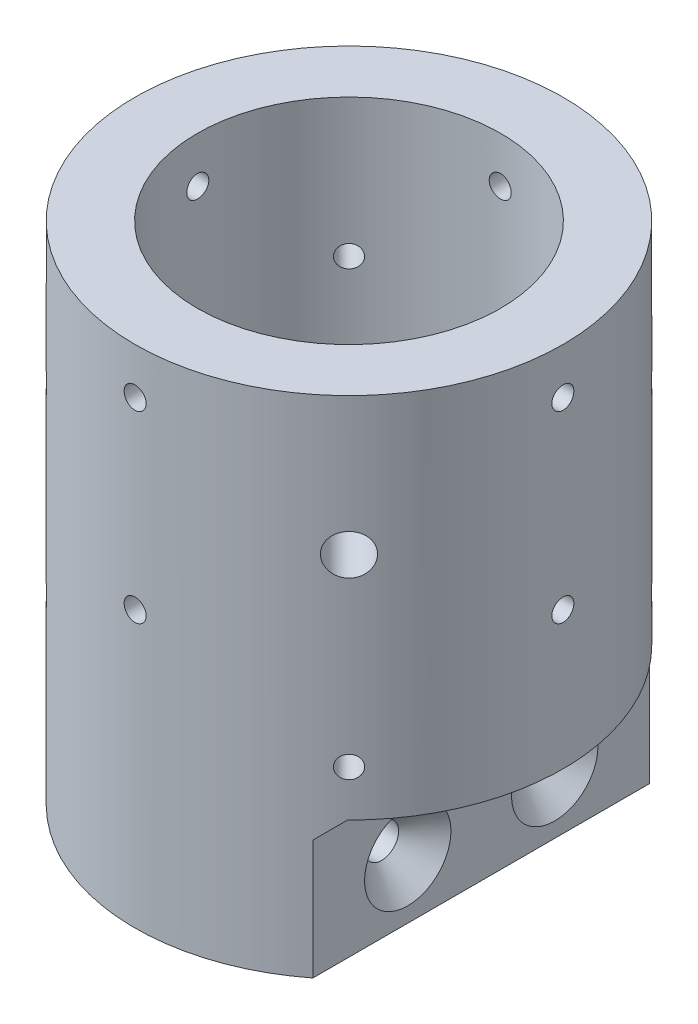
from build123d import *

# Parameters (mm, degrees)
SKETCH_1_R                       = 23.3
EXTRUDE_1_DEPTH                  = 5
SKETCH_2_R                       = 23.3
SKETCH_2_R_2                     = 16.5
EXTRUDE_2_DEPTH                  = 35
CHAMFER_8_SIZE                   = 2
SKETCH_3_R                       = 1.2
CUT_EXTRUDE_1_DEPTH              = 52.824511575
CUT_EXTRUDE_START                = -16.3
SKETCH_4_R                       = 1.2
CUT_EXTRUDE_2_DEPTH              = 36.524511747
PATTERN_CIRCULAR_1_COUNT         = 4
PATTERN_CIRCULAR_2_COUNT         = 4
PATTERN_LINEAR_3_COUNT           = 2
PATTERN_LINEAR_3_PITCH           = 20
PATTERN_START                    = -16.3
PATTERN_LINEAR_3_COPY_1_SKETCH_R = 1.2
PATTERN_LINEAR_3_COPY_1_DEPTH    = 36.524511747
PATTERN_LINEAR_3_COPY_2_SKETCH_R = 1.2
PATTERN_LINEAR_3_COPY_2_DEPTH    = 36.524511747
PATTERN_LINEAR_3_COPY_3_SKETCH_R = 1.2
PATTERN_LINEAR_3_COPY_3_DEPTH    = 36.524511747
PATTERN_LINEAR_4_COUNT           = 2
PATTERN_LINEAR_4_PITCH           = 20
PATTERN_LINEAR_4_COPY_1_SKETCH_R = 1.2
PATTERN_LINEAR_4_COPY_1_DEPTH    = 52.824511575
PATTERN_LINEAR_4_COPY_2_SKETCH_R = 1.2
PATTERN_LINEAR_4_COPY_2_DEPTH    = 52.824511575
PATTERN_LINEAR_4_COPY_3_SKETCH_R = 1.2
PATTERN_LINEAR_4_COPY_3_DEPTH    = 52.824511575
EXTRUDE_START                    = 15
EXTRUDE_3_DEPTH                  = 15
CUT_EXTRUDE_10_DEPTH             = 15
CHAMFER_4_SIZE                   = 2
CHAMFER_6_SIZE                   = 2
CHAMFER_7_SIZE                   = 2
HOLE_WIZARD_M41_D                = 3.7
HOLE_WIZARD_M41_CSINK_D          = 9.4
HOLE_WIZARD_M41_CSINK_ANGLE      = 90
SKETCH_17_R                      = 2.5
CUT_EXTRUDE_11_DEPTH             = 86
SKETCH_18_R                      = 2.2
SKETCH_18_R_2                    = 1.2
CUT_EXTRUDE_12_DEPTH             = 86


with BuildPart() as part:
    # Эскиз1 → Бобышка-Вытянуть1 (new body)
    with BuildSketch(Plane(origin=(0, 0, 0), x_dir=(1, 0, 0), z_dir=(0, 1, 0))):
        with Locations(Location((0, 0, 0), (0, 0, 270))):
            Circle(SKETCH_1_R)
    extrude(amount=EXTRUDE_1_DEPTH)

    # Эскиз2 → Бобышка-Вытянуть2 (add)
    with BuildSketch(Plane(origin=(0, 5, 0), x_dir=(1, 0, 0), z_dir=(0, 1, 0))):
        with Locations(Location((0, 0, 0), (0, 0, 270))):
            Circle(SKETCH_2_R)
        with Locations(Location((0, 0, 0), (0, 0, 270))):
            Circle(SKETCH_2_R_2, mode=Mode.SUBTRACT)
    extrude(amount=EXTRUDE_2_DEPTH)

    # Фаска8
    chamfer_8_edges = [part.edges().sort_by_distance(p)[0] for p in [
        (0, 5, -16.5),
    ]]
    chamfer(chamfer_8_edges, length=CHAMFER_8_SIZE)

    # Эскиз3 → Вырез-Вытянуть1 (cut, through all)
    with BuildSketch(Plane(origin=(0, 0, 0), x_dir=(0, 0, -1), z_dir=(1, 0, 0))):
        with Locations((0, 35)):
            Circle(SKETCH_3_R)
    cut_extrude_1 = extrude(amount=-CUT_EXTRUDE_1_DEPTH, mode=Mode.SUBTRACT)

    # Эскиз4 → Вырез-Вытянуть2 (cut, through all)
    with BuildSketch(Plane(origin=(0, 0, 0), x_dir=(0, -1, 0), z_dir=(0.7071067811865464, 0, 0.7071067811865488)).offset(CUT_EXTRUDE_START)):
        with Locations(Location((-5, 0, 0), (0, 0, 90))):
            Circle(SKETCH_4_R)
    cut_extrude_2 = extrude(amount=-CUT_EXTRUDE_2_DEPTH, mode=Mode.SUBTRACT)

    # Круговой массив1: Вырез-Вытянуть2 ×4 about axis
    pattern_circular_1_axis = Axis((0, 0, 0), (0, 1, 0))
    for i in range(1, PATTERN_CIRCULAR_1_COUNT):
        add(cut_extrude_2.rotate(pattern_circular_1_axis, i * 360 / PATTERN_CIRCULAR_1_COUNT), mode=Mode.SUBTRACT)

    # Круговой массив2: Вырез-Вытянуть1 ×4 about axis
    pattern_circular_2_axis = Axis((0, 5, 0), (0, -1, 0))
    for i in range(1, PATTERN_CIRCULAR_2_COUNT):
        add(cut_extrude_1.rotate(pattern_circular_2_axis, i * 360 / PATTERN_CIRCULAR_2_COUNT), mode=Mode.SUBTRACT)

    # Линейный массив3: Вырез-Вытянуть2 ×2
    with Locations(*[(0, i * PATTERN_LINEAR_3_PITCH, 0) for i in range(1, PATTERN_LINEAR_3_COUNT)]):
        add(cut_extrude_2, mode=Mode.SUBTRACT)

    # Линейный массив3 copy 1 sketch → Линейный массив3 copy 1 (cut, through all)
    with BuildSketch(Plane(origin=(0, 20, 0), x_dir=(0, -1, 0), z_dir=(0.7071067811865488, 0, -0.7071067811865464)).offset(PATTERN_START)):
        with Locations(Location((-5, 0, 0), (0, 0, 90))):
            Circle(PATTERN_LINEAR_3_COPY_1_SKETCH_R)
    extrude(amount=-PATTERN_LINEAR_3_COPY_1_DEPTH, mode=Mode.SUBTRACT)

    # Линейный массив3 copy 2 sketch → Линейный массив3 copy 2 (cut, through all)
    with BuildSketch(Plane(origin=(0, 20, 0), x_dir=(0, -1, 0), z_dir=(-0.7071067811865462, 0, -0.7071067811865489)).offset(PATTERN_START)):
        with Locations(Location((-5, 0, 0), (0, 0, 90))):
            Circle(PATTERN_LINEAR_3_COPY_2_SKETCH_R)
    extrude(amount=-PATTERN_LINEAR_3_COPY_2_DEPTH, mode=Mode.SUBTRACT)

    # Линейный массив3 copy 3 sketch → Линейный массив3 copy 3 (cut, through all)
    with BuildSketch(Plane(origin=(0, 20, 0), x_dir=(0, -1, 0), z_dir=(-0.7071067811865489, 0, 0.7071067811865462)).offset(PATTERN_START)):
        with Locations(Location((-5, 0, 0), (0, 0, 90))):
            Circle(PATTERN_LINEAR_3_COPY_3_SKETCH_R)
    extrude(amount=-PATTERN_LINEAR_3_COPY_3_DEPTH, mode=Mode.SUBTRACT)

    # Линейный массив4: Вырез-Вытянуть1 ×2
    with Locations(*[(0, -i * PATTERN_LINEAR_4_PITCH, 0) for i in range(1, PATTERN_LINEAR_4_COUNT)]):
        add(cut_extrude_1, mode=Mode.SUBTRACT)

    # Линейный массив4 copy 1 sketch → Линейный массив4 copy 1 (cut, through all)
    with BuildSketch(Plane(origin=(0, -20, 0), x_dir=(1, 0, 0), z_dir=(0, 0, 1))):
        with Locations((0, 35)):
            Circle(PATTERN_LINEAR_4_COPY_1_SKETCH_R)
    extrude(amount=-PATTERN_LINEAR_4_COPY_1_DEPTH, mode=Mode.SUBTRACT)

    # Линейный массив4 copy 2 sketch → Линейный массив4 copy 2 (cut, through all)
    with BuildSketch(Plane(origin=(0, -20, 0), x_dir=(0, 0, 1), z_dir=(-1, 0, 0))):
        with Locations((0, 35)):
            Circle(PATTERN_LINEAR_4_COPY_2_SKETCH_R)
    extrude(amount=-PATTERN_LINEAR_4_COPY_2_DEPTH, mode=Mode.SUBTRACT)

    # Линейный массив4 copy 3 sketch → Линейный массив4 copy 3 (cut, through all)
    with BuildSketch(Plane(origin=(0, -20, 0), x_dir=(-1, 0, 0), z_dir=(0, 0, -1))):
        with Locations((0, 35)):
            Circle(PATTERN_LINEAR_4_COPY_3_SKETCH_R)
    extrude(amount=-PATTERN_LINEAR_4_COPY_3_DEPTH, mode=Mode.SUBTRACT)

    # Эскиз12 → Бобышка-Вытянуть3 (add)
    with BuildSketch(Plane.XZ.offset(EXTRUDE_START)):
        with BuildLine():
            Line((14.39227801, 18.323545882), (14.39227801, -18.323545882))
            ThreePointArc((14.39227801, -18.323545882), (-23.3, 0), (14.39227801, 18.323545882))
        make_face()
        with BuildLine():
            Line((0, 15), (-2.783481901, 17.783481901))
            ThreePointArc((-2.783481901, 17.783481901), (-18, 0), (-2.783481901, -17.783481901))
            Line((-2.783481901, -17.783481901), (0, -15))
            Line((0, -15), (0, 15))
        make_face(mode=Mode.SUBTRACT)
    extrude(amount=-EXTRUDE_3_DEPTH)

    # Эскиз13 → Вырез-Вытянуть10 (cut)
    with BuildSketch(Plane.XZ.offset(15)):
        with BuildLine():
            Line((-2.678634034, -18.102898103), (0.3, -15.124264069))
            Line((0.3, -15.124264069), (0.3, 15.124264069))
            Line((0.3, 15.124264069), (-2.678634034, 18.102898103))
            ThreePointArc((-2.678634034, 18.102898103), (-18.3, 0), (-2.678634034, -18.102898103))
        make_face()
    extrude(amount=-CUT_EXTRUDE_10_DEPTH, mode=Mode.SUBTRACT)

    # Фаска4
    # the kernel refuses this chamfer: 2 mm, written as the material it adds along each edge
    with BuildSketch(Plane(origin=(14.39227801, 0, 23.466911858), x_dir=(-0.027495876610586494, -0.9996219169112968, 0), z_dir=(0, 0, -1))) as chamfer_4_piece_1_section:
        Polygon((CHAMFER_4_SIZE * 0.999621916911, -CHAMFER_4_SIZE * 0.0274958766106), (-CHAMFER_4_SIZE * 0.0274958766106, -CHAMFER_4_SIZE * 0.999621916911), (0, 0), align=None)
    chamfer_4_piece_1 = extrude(amount=46.933823716, mode=Mode.PRIVATE)
    chamfer_4_piece_1 = chamfer_4_piece_1 & Plane(origin=(0, -0.666162294, 0), x_dir=(0, 0, 1), z_dir=(0, -1, 0)) * Cylinder(23.3, 102, mode=Mode.PRIVATE)
    add(chamfer_4_piece_1)

    # Фаска6
    chamfer_6_edges = [part.edges().sort_by_distance(p)[0] for p in [
        (-1.189317017, 0, -16.613581086),
        (0.3, 0, 0),
        (-1.189317017, 0, 16.613581086),
        (-18.3, 0, 0),
    ]]
    chamfer(chamfer_6_edges, length=CHAMFER_6_SIZE)

    # Фаска7
    chamfer_7_edges = [part.edges().sort_by_distance(p)[0] for p in [
        (-18.3, -15, 0),
        (-1.189317017, -15, -16.613581086),
        (0.3, -15, 0),
        (-1.189317017, -15, 16.613581086),
    ]]
    chamfer(chamfer_7_edges, length=CHAMFER_7_SIZE)

    # Зенковка для винта с полупотайной головкой M41 (through all)
    with Locations(Plane(origin=(14.39227801, -676.204468703, -24.026727422), x_dir=(0, 0.02016497398735891, -0.9997966662397356), z_dir=(1, 0, 0))):
        with Locations((-18.557598735, 668.053200176), (-2.564104754, 667.730626196)):
            CounterSinkHole(HOLE_WIZARD_M41_D / 2, HOLE_WIZARD_M41_CSINK_D / 2, counter_sink_angle=HOLE_WIZARD_M41_CSINK_ANGLE)

    # Эскиз17 → Вырез-Вытянуть11 (cut)
    with BuildSketch(Plane.XZ.offset(15)):
        with Locations(Location((5.328772167, 0, 0), (0, 0, 270))):
            Circle(SKETCH_17_R)
    extrude(amount=-CUT_EXTRUDE_11_DEPTH, mode=Mode.SUBTRACT)

    # Эскиз18 → Вырез-Вытянуть12 (cut)
    with BuildSketch(Plane(origin=(0, 0, 0), x_dir=(-0.7071067811865487, 0, 0.7071067811865464), z_dir=(-0.7071067811865464, 0, -0.7071067811865487))):
        with Locations((0, 25)):
            Circle(SKETCH_18_R)
        with Locations(Location((0, 25, 0), (0, 0, 180))):
            Circle(SKETCH_18_R_2, mode=Mode.SUBTRACT)
    extrude(amount=-CUT_EXTRUDE_12_DEPTH, mode=Mode.SUBTRACT)


solid = part.part
